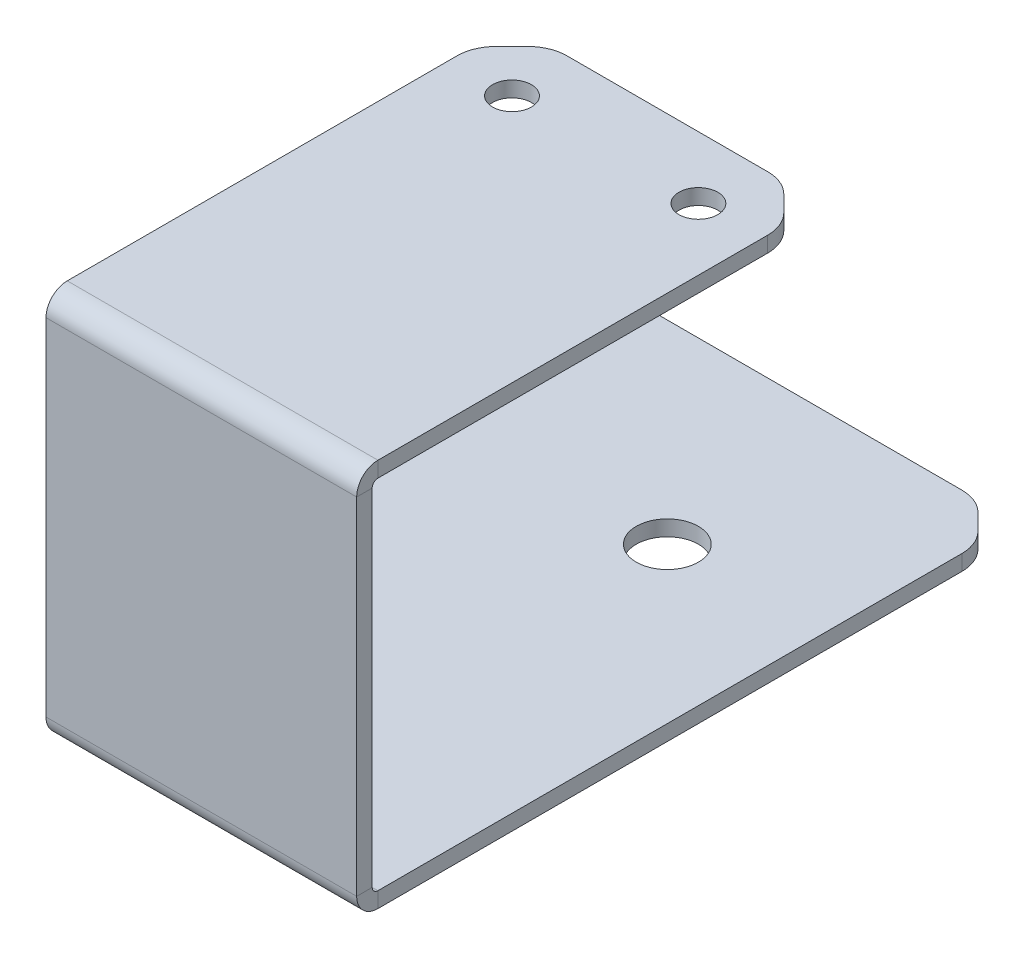
from build123d import *

# Parameters (mm, degrees)
SKETCH1_R                    = 3
SKETCH1_R_2                  = 4
BASE_FLANGE1_DEPTH           = 2
SKETCH6_W                    = 90.588867986
SKETCH6_H                    = 42.612496281
CUT_EXTRUDE1_DEPTH           = 10
DELETEFACE2_START            = -2
DELETEFACE2_DEPTH            = 2
DELETEFACE3_START            = 50
DELETEFACE3_OUTLINE_W        = 40
DELETEFACE3_OUTLINE_H        = 2
DELETEFACE3_DEPTH            = 10
EDGE_FLANGE1_STRIP_W         = 9.4732
EDGE_FLANGE1_STRIP_H         = 2
EDGE_FLANGE1_STRIP_CUT_DEPTH = 40
EDGE_FLANGE1_DEPTH           = 40
EDGE_FLANGE2_STRIP_W         = 9.4732
EDGE_FLANGE2_STRIP_H         = 2
EDGE_FLANGE2_STRIP_CUT_DEPTH = 40
EDGE_FLANGE2_DEPTH           = 40
SKETCH15_R                   = 2.5
CUT_EXTRUDE2_DEPTH           = 10
CHAMFER1_SIZE                = 5
FILLET1_R                    = 5


# Read off the part's stored shape, not the designer's step: DeleteFace2, DeleteFace3
# Sheet-metal steps are written as plain solids
with BuildPart() as part:
    # Sketch1 → Base-Flange1 (new body)
    with BuildSketch(Plane(origin=(0, 0, 0), x_dir=(1, 0, 0), z_dir=(0, 1, 0))):
        with BuildLine():
            Line((-17.071067812, 52.928932188), (-12.928932188, 57.071067812))
            ThreePointArc((-12.928932188, 57.071067812), (-9.6846987, 59.238795325), (-5.857864376, 60))
            Line((-5.857864376, 60), (5.857864376, 60))
            ThreePointArc((5.857864376, 60), (9.6846987, 59.238795325), (12.928932188, 57.071067812))
            Line((12.928932188, 57.071067812), (17.071067812, 52.928932188))
            ThreePointArc((17.071067812, 52.928932188), (19.238795325, 49.6846987), (20, 45.857864376))
            Line((20, 45.857864376), (20, -45.857864376))
            ThreePointArc((20, -45.857864376), (19.238795325, -49.6846987), (17.071067812, -52.928932188))
            Line((17.071067812, -52.928932188), (12.928932188, -57.071067812))
            ThreePointArc((12.928932188, -57.071067812), (9.6846987, -59.238795325), (5.857864376, -60))
            Line((5.857864376, -60), (-5.857864376, -60))
            ThreePointArc((-5.857864376, -60), (-9.6846987, -59.238795325), (-12.928932188, -57.071067812))
            Line((-12.928932188, -57.071067812), (-17.071067812, -52.928932188))
            ThreePointArc((-17.071067812, -52.928932188), (-19.238795325, -49.6846987), (-20, -45.857864376))
            Line((-20, -45.857864376), (-20, -39.142135624))
            ThreePointArc((-20, -39.142135624), (-20.761204675, -35.3153013), (-22.928932188, -32.071067812))
            Line((-22.928932188, -32.071067812), (-27.071067812, -27.928932188))
            ThreePointArc((-27.071067812, -27.928932188), (-30.3153013, -25.761204675), (-34.142135624, -25))
            Line((-34.142135624, -25), (-45.857864376, -25))
            ThreePointArc((-45.857864376, -25), (-49.6846987, -24.238795325), (-52.928932188, -22.071067812))
            Line((-52.928932188, -22.071067812), (-57.071067812, -17.928932188))
            ThreePointArc((-57.071067812, -17.928932188), (-59.238795325, -14.6846987), (-60, -10.857864376))
            Line((-60, -10.857864376), (-60, 10.857864376))
            ThreePointArc((-60, 10.857864376), (-59.238795325, 14.6846987), (-57.071067812, 17.928932188))
            Line((-57.071067812, 17.928932188), (-52.928932188, 22.071067812))
            ThreePointArc((-52.928932188, 22.071067812), (-49.6846987, 24.238795325), (-45.857864376, 25))
            Line((-45.857864376, 25), (-34.142135624, 25))
            ThreePointArc((-34.142135624, 25), (-30.3153013, 25.761204675), (-27.071067812, 27.928932188))
            Line((-27.071067812, 27.928932188), (-22.928932188, 32.071067812))
            ThreePointArc((-22.928932188, 32.071067812), (-20.761204675, 35.3153013), (-20, 39.142135624))
            Line((-20, 39.142135624), (-20, 45.857864376))
            ThreePointArc((-20, 45.857864376), (-19.238795325, 49.6846987), (-17.071067812, 52.928932188))
        make_face()
        with Locations(Location((0, 42.5, 0), (0, 0, 270))):
            Circle(SKETCH1_R, mode=Mode.SUBTRACT)
        with Locations(Location((0, -42.5, 0), (0, 0, 270))):
            Circle(SKETCH1_R, mode=Mode.SUBTRACT)
        with Locations(Location((0, 0, 0), (0, 0, 270))):
            Circle(SKETCH1_R_2, mode=Mode.SUBTRACT)
        with Locations(Location((-35.23885867, -15, 0), (0, 0, 270))):
            Circle(SKETCH1_R_2, mode=Mode.SUBTRACT)
        with Locations(Location((-35.23885867, 15, 0), (0, 0, 270))):
            Circle(SKETCH1_R_2, mode=Mode.SUBTRACT)
    extrude(amount=-BASE_FLANGE1_DEPTH)

    # Sketch6 → Cut-Extrude1 (cut)
    with BuildSketch(Plane(origin=(0, 0, 0), x_dir=(1, 0, 0), z_dir=(0, 1, 0))):
        with Locations((11.152298369, 46.306248141)):
            Rectangle(SKETCH6_W, SKETCH6_H)
    extrude(amount=-CUT_EXTRUDE1_DEPTH, mode=Mode.SUBTRACT)

    # DeleteFace2 outline → DeleteFace2 (add)
    with BuildSketch(Plane(origin=(0, 0, 0), x_dir=(1, 0, 0), z_dir=(0, 1, 0)).offset(DELETEFACE2_START)):
        with BuildLine():
            Line((5.857864376, -60), (10, -60))
            Line((10, -60), (12.928932188, -57.071067812))
            ThreePointArc((12.928932188, -57.071067812), (9.6846987, -59.238795325), (5.857864376, -60))
        make_face()
        with BuildLine():
            Line((-20, -50), (-17.071067812, -52.928932188))
            ThreePointArc((-17.071067812, -52.928932188), (-19.238795325, -49.6846987), (-20, -45.857864376))
            Line((-20, -45.857864376), (-20, -50))
        make_face()
        with BuildLine():
            Line((-10, -60), (-5.857864376, -60))
            ThreePointArc((-5.857864376, -60), (-9.6846987, -59.238795325), (-12.928932188, -57.071067812))
            Line((-12.928932188, -57.071067812), (-10, -60))
        make_face()
        with BuildLine():
            ThreePointArc((20, -45.857864376), (19.238795325, -49.6846987), (17.071067812, -52.928932188))
            Line((17.071067812, -52.928932188), (20, -50))
            Line((20, -50), (20, -45.857864376))
        make_face()
    extrude(amount=DELETEFACE2_DEPTH)

    # DeleteFace3 outline → DeleteFace3 (add)
    with BuildSketch(Plane.XY.offset(DELETEFACE3_START)):
        with Locations((0, -1)):
            Rectangle(DELETEFACE3_OUTLINE_W, DELETEFACE3_OUTLINE_H)
    extrude(amount=DELETEFACE3_DEPTH)

    # Edge-Flange1 strip (across the edge) → Edge-Flange1 strip cut (cut)
    with BuildSketch(Plane(origin=(-20, 0, 60), x_dir=(0, 0, -1), z_dir=(1, 0, 0))):
        with Locations((-2, -1)):
            Rectangle(EDGE_FLANGE1_STRIP_W, EDGE_FLANGE1_STRIP_H)
    extrude(amount=EDGE_FLANGE1_STRIP_CUT_DEPTH, mode=Mode.SUBTRACT)

    # Edge-Flange1 section (across the edge) → Edge-Flange1 (add)
    with BuildSketch(Plane(origin=(-20, 0, 60), x_dir=(0, 0, -1), z_dir=(1, 0, 0))):
        with BuildLine():
            Line((0, 0.7366), (0, 48))
            Line((0, 48), (2, 48))
            Line((2, 48), (2, 0.7366))
            ThreePointArc((2, 0.7366), (2.215745145, 0.215745145), (2.7366, 0))
            Line((2.7366, 0), (2.7366, -2))
            ThreePointArc((2.7366, -2), (0.801531583, -1.198468417), (0, 0.7366))
        make_face()
    extrude(amount=EDGE_FLANGE1_DEPTH)

    # Edge-Flange2 strip (across the edge) → Edge-Flange2 strip cut (cut)
    with BuildSketch(Plane(origin=(-20, 48, 58), x_dir=(0, -1, 0), z_dir=(1, 0, 0))):
        with Locations((-2, -1)):
            Rectangle(EDGE_FLANGE2_STRIP_W, EDGE_FLANGE2_STRIP_H)
    extrude(amount=EDGE_FLANGE2_STRIP_CUT_DEPTH, mode=Mode.SUBTRACT)

    # Edge-Flange2 section (across the edge) → Edge-Flange2 (add)
    with BuildSketch(Plane(origin=(-20, 48, 58), x_dir=(0, -1, 0), z_dir=(1, 0, 0))):
        with BuildLine():
            Line((0, 0.7366), (0, 58))
            Line((0, 58), (2, 58))
            Line((2, 58), (2, 0.7366))
            ThreePointArc((2, 0.7366), (2.215745145, 0.215745145), (2.7366, 0))
            Line((2.7366, 0), (2.7366, -2))
            ThreePointArc((2.7366, -2), (0.801531583, -1.198468417), (0, 0.7366))
        make_face()
    extrude(amount=EDGE_FLANGE2_DEPTH)

    # Sketch15 → Cut-Extrude2 (cut)
    with BuildSketch(Plane(origin=(0, 48, 0), x_dir=(1, 0, 0), z_dir=(0, 1, 0))):
        with Locations(Location((-12, -8, 0), (0, 0, 270))):
            Circle(SKETCH15_R)
        with Locations(Location((12, -8, 0), (0, 0, 270))):
            Circle(SKETCH15_R)
    extrude(amount=-CUT_EXTRUDE2_DEPTH, mode=Mode.SUBTRACT)

    # Chamfer1
    chamfer1_edges = [part.edges().sort_by_distance(p)[0] for p in [
        (20, -1, -25),
        (-20, 47, 0),
        (20, 47, 0),
    ]]
    chamfer(chamfer1_edges, length=CHAMFER1_SIZE)

    # Fillet1
    fillet1_edges = [part.edges().sort_by_distance(p)[0] for p in [
        (15, -1, -25),
        (20, -1, -20),
        (-15, 47, 0),
        (15, 47, 0),
        (20, 47, 5),
        (-20, 47, 5),
    ]]
    fillet(fillet1_edges, radius=FILLET1_R)


solid = part.part
